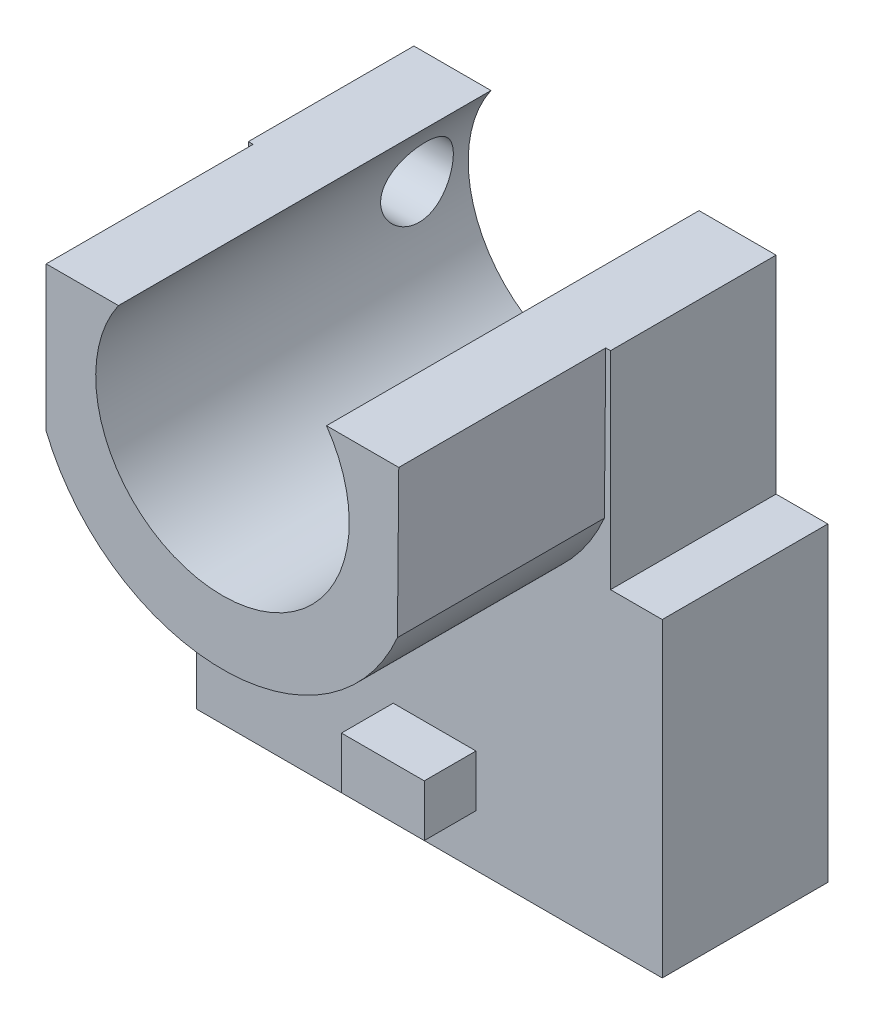
from build123d import *

# Parameters (mm, degrees)
BOSS_EXTRUDE1_DEPTH     = 16
SKETCH2_W               = 8
SKETCH2_H               = 5
BOSS_EXTRUDE2_DEPTH     = 5
SKETCH3_R               = 12.25
CUT_EXTRUDE1_DEPTH      = 16
BOSS_EXTRUDE3_START     = 20
BOSS_EXTRUDE3_DEPTH     = 20
CUT_EXTRUDE2_DEPTH      = 1
CUT_EXTRUDE2_DEPTH_BACK = 8
SKETCH6_R               = 3.5


with BuildPart() as part:
    # Sketch1 → Boss-Extrude1 (new body)
    with BuildSketch(Plane.XY):
        Polygon((17.5, 15), (22.5, 15), (22.5, -15), (-22.5, -15), (-22.5, 15), (-17.5, 15), (-17.5, 35), (17.5, 35), align=None)
    extrude(amount=BOSS_EXTRUDE1_DEPTH)

    # Sketch2 → Boss-Extrude2 (add)
    with BuildSketch(Plane.XY.offset(16)):
        with Locations((0.5, -7.5)):
            Rectangle(SKETCH2_W, SKETCH2_H)
    extrude(amount=BOSS_EXTRUDE2_DEPTH)

    # Sketch3 → Cut-Extrude1 (cut)
    with BuildSketch(Plane.XY.offset(16)):
        with Locations((0, 28)):
            Circle(SKETCH3_R)
    extrude(amount=-CUT_EXTRUDE1_DEPTH, mode=Mode.SUBTRACT)

    # Sketch4 → Boss-Extrude3 (add)
    with BuildSketch(Plane.XY.offset(16).offset(BOSS_EXTRUDE3_START)):
        with BuildLine():
            Line((-17.036725037, 35), (-17.036725037, 21))
            ThreePointArc((-17.036725037, 21), (-0.167488081, 9.582021073), (16.906605879, 20.691328599))
            Line((16.906605879, 20.691328599), (17.036725037, 35))
            Line((17.036725037, 35), (10.052984631, 35))
            ThreePointArc((10.052984631, 35), (0, 15.75), (-10.052984631, 35))
            Line((-10.052984631, 35), (-17.036725037, 35))
        make_face()
    extrude(amount=-BOSS_EXTRUDE3_DEPTH)

    # Sketch6 → Cut-Extrude2 (cut, two sides: drawn at the far end of the back side and taken through both)
    with BuildSketch(Plane.ZY.offset(17.5).offset(-CUT_EXTRUDE2_DEPTH_BACK)):
        with Locations((5, 29)):
            Circle(SKETCH6_R)
    extrude(amount=CUT_EXTRUDE2_DEPTH + CUT_EXTRUDE2_DEPTH_BACK, mode=Mode.SUBTRACT)


solid = part.part
